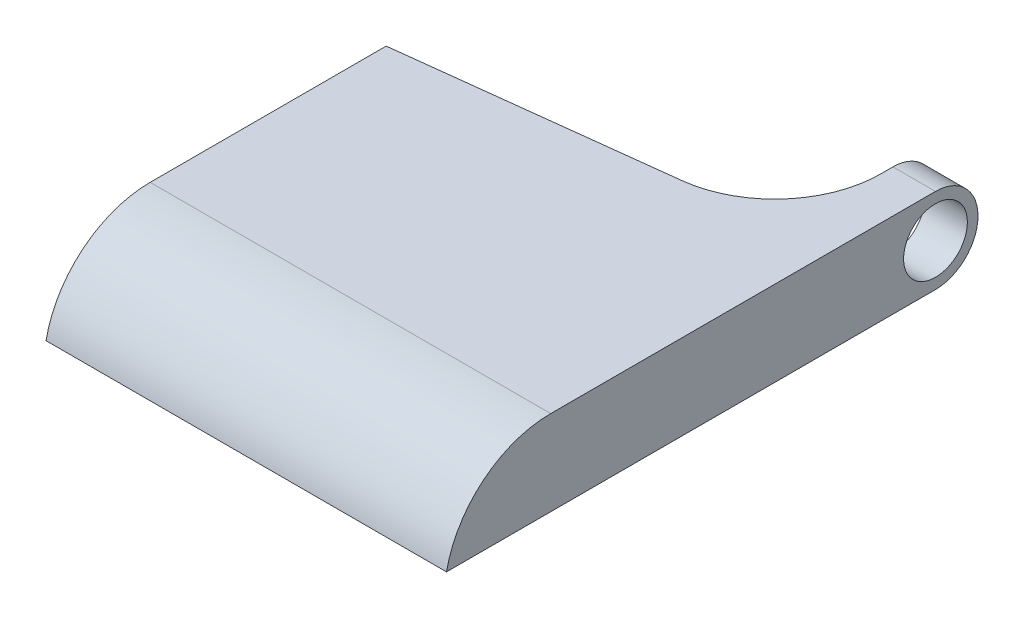
from build123d import *

# Parameters (mm, degrees)
BOSS_EXTRUDE1_DEPTH = 4
FILLET1_R           = 5
FILLET2_R           = 5
SKETCH6_R           = 1.5
CUT_EXTRUDE1_DEPTH  = 32.558605799


with BuildPart() as part:
    # Sketch2 → Boss-Extrude1 (new body)
    with BuildSketch(Plane(origin=(0, 0, 0), x_dir=(1, 0, 0), z_dir=(0, 1, 0))):
        Polygon((0, 0), (18.84, 0), (18.84, 25), (16.84, 25), (16.84, 18), (0, 16), align=None)
    extrude(amount=BOSS_EXTRUDE1_DEPTH)

    # Fillet1
    # the kernel refuses this fillet: 5 mm, written as the material it takes off along each edge
    with BuildSketch(Plane(origin=(-12.247448714, 4, 0), x_dir=(0, -1.0, -1.5634160632766466e-12), z_dir=(1, 0, 0))) as fillet1_piece_1:
        with BuildLine():
            CenterArc((5, 4.898979486), FILLET1_R, 180, 78.463040967)
            Line((0, 4.898979486), (-0.1, 4.898979486))
            Line((-0.1, 4.898979486), (-0.1, 0))
            Line((-0.1, 0), (0, -0.1))
            ThreePointArc((0, -0.1), (2, -0.1), (3.98, -0.09797959))
            Line((3.98, -0.09797959), (4, 0))
        make_face()
    extrude(amount=43.334897428, mode=Mode.SUBTRACT)

    # Fillet2
    fillet2_edges = [part.edges().sort_by_distance(p)[0] for p in [
        (16.84, 2, -18),
    ]]
    fillet(fillet2_edges, radius=FILLET2_R)

    # Sketch6 → Cut-Extrude1 (cut, through all)
    with BuildSketch(Plane(origin=(18.84, 0, 0), x_dir=(0, 0, -1), z_dir=(1, 0, 0))):
        with Locations((23, 2)):
            Circle(SKETCH6_R)
        with BuildLine():
            Line((25, 4), (23, 4))
            ThreePointArc((23, 4), (24.414213562, 3.414213562), (25, 2))
            Line((25, 2), (25, 4))
        make_face()
        with BuildLine():
            Line((25, 0), (25, 2))
            ThreePointArc((25, 2), (24.414213562, 0.585786438), (23, 0))
            Line((23, 0), (25, 0))
        make_face()
    extrude(amount=-CUT_EXTRUDE1_DEPTH, mode=Mode.SUBTRACT)


solid = part.part
